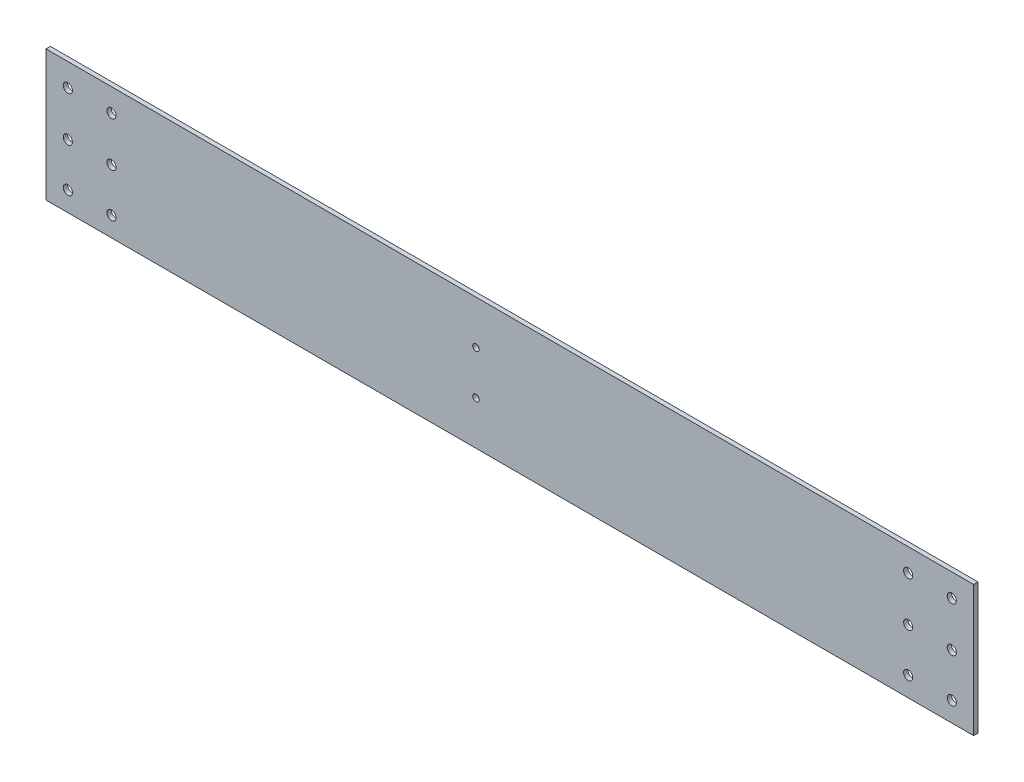
from build123d import *

# Parameters (mm, degrees)
SKETCH_1_W          = 425
SKETCH_1_H          = 60
EXTRUDE_1_DEPTH     = 2
SKETCH_2_R          = 2.1
SKETCH_2_R_2        = 1.5
CUT_EXTRUDE_1_DEPTH = 215.61651847


with BuildPart() as part:
    # 草图1 → 凸台-拉伸1 (new body)
    with BuildSketch(Plane.XY):
        Rectangle(SKETCH_1_W, SKETCH_1_H)
    extrude(amount=EXTRUDE_1_DEPTH)

    # 草图2 → 切除-拉伸1 (cut, through all)
    with BuildSketch(Plane(origin=(0, 0, 0), x_dir=(-1, 0, 0), z_dir=(0, 0, -1))):
        with Locations((202.5, -21)):
            Circle(SKETCH_2_R)
        with Locations((182.5, -21)):
            Circle(SKETCH_2_R)
        with Locations((202.5, 19.5)):
            Circle(SKETCH_2_R)
        with Locations((202.5, -1)):
            Circle(SKETCH_2_R)
        with Locations((182.5, -1)):
            Circle(SKETCH_2_R)
        with Locations((182.5, 19.5)):
            Circle(SKETCH_2_R)
        with Locations((-182.5, -21)):
            Circle(SKETCH_2_R)
        with Locations((-202.5, -21)):
            Circle(SKETCH_2_R)
        with Locations((-182.5, -1)):
            Circle(SKETCH_2_R)
        with Locations((-202.5, -1)):
            Circle(SKETCH_2_R)
        with Locations((-202.5, 19.5)):
            Circle(SKETCH_2_R)
        with Locations((-182.5, 19.5)):
            Circle(SKETCH_2_R)
        with Locations((15.5, -10)):
            Circle(SKETCH_2_R_2)
        with Locations((15.5, 10)):
            Circle(SKETCH_2_R_2)
    extrude(amount=-CUT_EXTRUDE_1_DEPTH, mode=Mode.SUBTRACT)


solid = part.part
